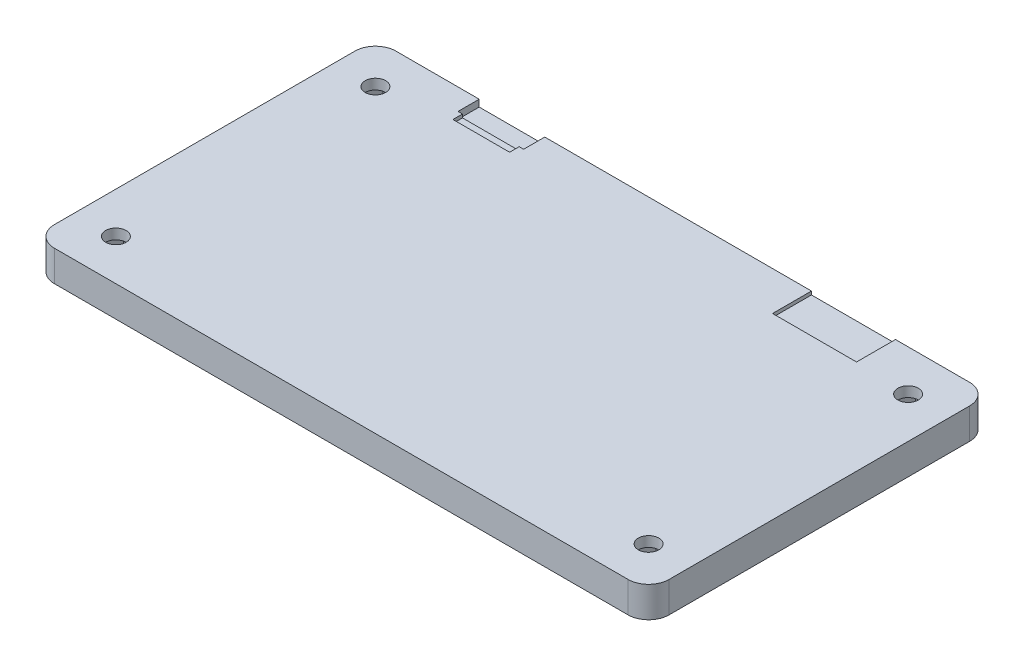
from build123d import *

# Parameters (mm, degrees)
SKETCH_1_R          = 1.5
EXTRUDE_1_DEPTH     = 3.5
SKETCH_2_W          = 8.3
SKETCH_2_H          = 1.4
SKETCH_2_W_2        = 12.3
SKETCH_2_H_2        = 5.7
CUT_EXTRUDE_1_DEPTH = 0.5
SKETCH_2_3_W        = 9.6
SKETCH_2_3_H        = 3.1
CUT_EXTRUDE_2_DEPTH = 1
CUT_EXTRUDE_3_DEPTH = 2
EXTRUDE_START       = 1
EXTRUDE_3_DEPTH     = 1


with BuildPart() as part:
    # 草图1 → 凸台-拉伸1 (new body)
    with BuildSketch(Plane(origin=(0, 0, 0), x_dir=(1, 0, 0), z_dir=(0, 1, 0))):
        with BuildLine():
            Line((-42, -25), (42, -25))
            ThreePointArc((42, -25), (44.121320344, -24.121320344), (45, -22))
            Line((45, -22), (45, 22))
            ThreePointArc((45, 22), (44.121320344, 24.121320344), (42, 25))
            Line((42, 25), (-42, 25))
            ThreePointArc((-42, 25), (-44.121320344, 24.121320344), (-45, 22))
            Line((-45, 22), (-45, -22))
            ThreePointArc((-45, -22), (-44.121320344, -24.121320344), (-42, -25))
        make_face()
        with Locations((-39, 19)):
            Circle(SKETCH_1_R, mode=Mode.SUBTRACT)
        with Locations((39, 19)):
            Circle(SKETCH_1_R, mode=Mode.SUBTRACT)
        with Locations((-39, -19)):
            Circle(SKETCH_1_R, mode=Mode.SUBTRACT)
        with Locations((39, -19)):
            Circle(SKETCH_1_R, mode=Mode.SUBTRACT)
    extrude(amount=EXTRUDE_1_DEPTH)

    # 草图2 → 切除-拉伸1 (cut)
    with BuildSketch(Plane(origin=(0, 3.5, 0), x_dir=(1, 0, 0), z_dir=(0, 1, 0))):
        with Locations((-25, 21.2)):
            Rectangle(SKETCH_2_W, SKETCH_2_H)
        with Locations((25, 22.15)):
            Rectangle(SKETCH_2_W_2, SKETCH_2_H_2)
    extrude(amount=-CUT_EXTRUDE_1_DEPTH, mode=Mode.SUBTRACT)

    # 草图2<3> → 切除-拉伸2 (cut)
    with BuildSketch(Plane(origin=(0, 3.5, 0), x_dir=(1, 0, 0), z_dir=(0, 1, 0))):
        with Locations((-25, 23.45)):
            Rectangle(SKETCH_2_3_W, SKETCH_2_3_H)
    extrude(amount=-CUT_EXTRUDE_2_DEPTH, mode=Mode.SUBTRACT)

    # 草图3 → 切除-拉伸3 (cut)
    with BuildSketch(Plane.XZ):
        Polygon((-37.4988893, 21.6), (-40.5011107, 21.6), (-42.0022214, 19), (-40.5011107, 16.4), (-37.4988893, 16.4), (-35.9977786, 19), align=None)
        Polygon((-37.4988893, -16.4), (-40.5011107, -16.4), (-42.0022214, -19), (-40.5011107, -21.6), (-37.4988893, -21.6), (-35.9977786, -19), align=None)
        Polygon((40.5011107, -16.4), (37.4988893, -16.4), (35.9977786, -19), (37.4988893, -21.6), (40.5011107, -21.6), (42.0022214, -19), align=None)
        Polygon((37.4988893, 21.6), (35.9977786, 19), (37.4988893, 16.4), (40.5011107, 16.4), (42.0022214, 19), (40.5011107, 21.6), align=None)
    extrude(amount=-CUT_EXTRUDE_3_DEPTH, mode=Mode.SUBTRACT)

    # 草图5 → 凸台-拉伸3 (add)
    with BuildSketch(Plane.XZ.offset(EXTRUDE_START)):
        with BuildLine():
            Line((-45, 22), (-45, -22))
            ThreePointArc((-45, -22), (-44.121320344, -24.121320344), (-42, -25))
            Line((-42, -25), (42, -25))
            ThreePointArc((42, -25), (44.121320344, -24.121320344), (45, -22))
            Line((45, -22), (45, 22))
            ThreePointArc((45, 22), (44.121320344, 24.121320344), (42, 25))
            Line((42, 25), (-42, 25))
            ThreePointArc((-42, 25), (-44.121320344, 24.121320344), (-45, 22))
        make_face()
        Polygon((35.9977786, 19), (37.4988893, 16.4), (40.5011107, 16.4), (42.0022214, 19), (40.5011107, 21.6), (37.4988893, 21.6), align=None, mode=Mode.SUBTRACT)
        Polygon((37.4988893, -16.4), (35.9977786, -19), (37.4988893, -21.6), (40.5011107, -21.6), (42.0022214, -19), (40.5011107, -16.4), align=None, mode=Mode.SUBTRACT)
        Polygon((-40.5011107, -16.4), (-42.0022214, -19), (-40.5011107, -21.6), (-37.4988893, -21.6), (-35.9977786, -19), (-37.4988893, -16.4), align=None, mode=Mode.SUBTRACT)
        Polygon((-37.4988893, 21.6), (-40.5011107, 21.6), (-42.0022214, 19), (-40.5011107, 16.4), (-37.4988893, 16.4), (-35.9977786, 19), align=None, mode=Mode.SUBTRACT)
    extrude(amount=-EXTRUDE_3_DEPTH)


solid = part.part
